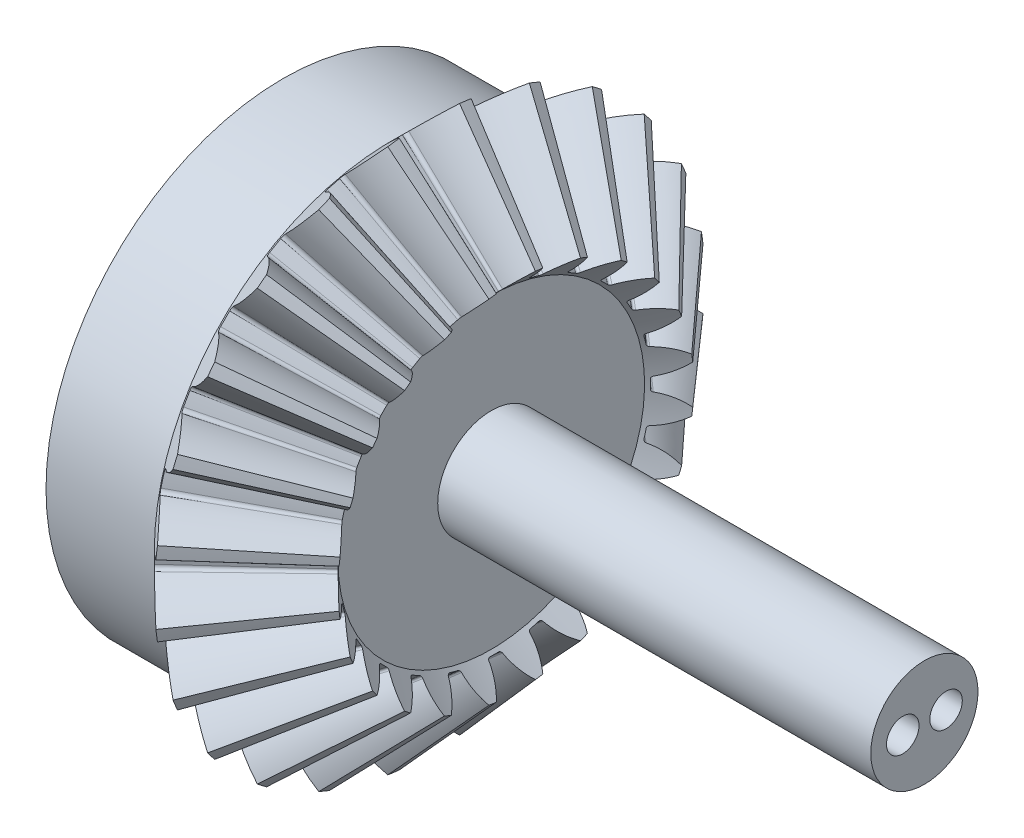
from build123d import *

# Parameters (mm, degrees)
TEETHCUTS_COUNT     = 24
TEETHCUTS_ANGLE     = 345
HUBSKE_R            = 21.899008976
HUB_DEPTH           = 0.0001016
BORSKE_R            = 8
BORE_DEPTH          = 26.101041824
SKETCH1_R           = 21.899008976
SKETCH1_R_2         = 8
BOSS_EXTRUDE1_DEPTH = 10
BOSS_EXTRUDE2_START = -19.228195468
SKETCH2_R           = 8
BOSS_EXTRUDE2_DEPTH = 19.228195468
SKETCH3_R           = 4.95
SKETCH3_R_2         = 1.5
BOSS_EXTRUDE3_DEPTH = 40
CUT_EXTRUDE1_START  = -20
SKETCH5_R           = 1.5
CUT_EXTRUDE1_DEPTH  = 20


with BuildPart() as part:
    # BasProSke → Base-Revolve (revolve)
    with BuildSketch(Plane(origin=(0, 0, 0), x_dir=(1, 0, 0), z_dir=(0, 1, 0)), mode=Mode.PRIVATE) as base_revolve_sk:
        Polygon((0, 0), (0, 21.899008978), (3.515204589, 25.414213561), (11.500485955, 16.428932179), (9.228093868, 14.156540096), (9.228093868, 0), align=None)
    revolve(base_revolve_sk.sketch.rotate(Axis((-10, 0, 0), (1, 0, 0)), 180), axis=Axis((-10, 0, 0), (1, 0, 0)))

    # ToothCut: read off the stored shape, not the designer's step
    # ToothCut: loft between two sections, ruled curve by curve
    toothcut_from = [
        Edge.make_bspline([(26.10720239, 0.006211364, -0.009172097), (26.102912454, 0.001921428, -0.014982426), (26.097002164, -0.003988861, -0.014143385), (26.093614444, -0.007376582, -0.007243115)], [0, 0, 0, 0, 1, 1, 1, 1], 3, [1, 0.76634411, 0.76634411, 1]),
        Edge.make_bspline([(26.093614444, -0.007376582, 0.007243115), (26.097002164, -0.003988861, 0.014143385), (26.102912454, 0.001921428, 0.014982426), (26.10720239, 0.006211364, 0.009172097)], [0, 0, 0, 0, 1, 1, 1, 1], 3, [1, 0.76634411, 0.76634411, 1]),
        Edge.make_bspline([(26.093614444, -0.007376582, -0.007243115), (26.093148172, -0.007842854, -0.006293391), (26.092777356, -0.00821367, -0.005262961), (26.092508857, -0.008482169, -0.004170894)], [0, 0, 0, 0, 1, 1, 1, 1], 3, [1, 0.993831806, 0.993831806, 1]),
        Edge.make_bspline([(26.092508857, -0.008482169, 0.004170894), (26.092777356, -0.00821367, 0.005262961), (26.093148172, -0.007842854, 0.006293391), (26.093614444, -0.007376582, 0.007243115)], [0, 0, 0, 0, 1, 1, 1, 1], 3, [1, 0.993831806, 0.993831806, 1]),
        Edge.make_bspline([(26.092508857, -0.008482169, -0.004170894), (26.091838336, -0.009152689, -0.001443682), (26.091838336, -0.009152689, 0.001443682), (26.092508857, -0.008482169, 0.004170894)], [0, 0, 0, 0, 1, 1, 1, 1], 3, [1, 0.963021929, 0.963021929, 1]),
        Edge.make_line((26.10720239, 0.006211364, 0.009172097), (26.10720239, 0.006211364, -0.009172097)),
    ]
    toothcut_to = [
        Edge.make_bspline([(3.750237088, 25.64924606, -3.148942644), (2.856031609, 24.755040582, -2.045484157), (1.79166118, 23.690670155, -1.303150883), (0.628286037, 22.527295014, -0.971572738)], [0, 0, 0, 0, 1, 1, 1, 1], 3, [1, 0.977714451, 0.977714451, 1]),
        Edge.make_bspline([(0.628286037, 22.527295014, 0.971572738), (1.79166118, 23.690670155, 1.303150883), (2.856031609, 24.755040582, 2.045484157), (3.750237088, 25.64924606, 3.148942644)], [0, 0, 0, 0, 1, 1, 1, 1], 3, [1, 0.977714451, 0.977714451, 1]),
        Edge.make_bspline([(0.628286037, 22.527295014, -0.971572738), (0.495266175, 22.394275152, -0.933660221), (0.410759708, 22.309768685, -0.783516157), (0.41447282, 22.313481797, -0.591687192)], [0, 0, 0, 0, 1, 1, 1, 1], 3, [1, 0.843380094, 0.843380094, 1]),
        Edge.make_bspline([(0.41447282, 22.313481797, 0.591687192), (0.410759708, 22.309768685, 0.783516157), (0.495266175, 22.394275152, 0.933660221), (0.628286037, 22.527295014, 0.971572738)], [0, 0, 0, 0, 1, 1, 1, 1], 3, [1, 0.843380094, 0.843380094, 1]),
        Edge.make_bspline([(0.41447282, 22.313481797, -0.591687192), (0.422107143, 22.321116121, -0.197278313), (0.422107143, 22.321116121, 0.197278313), (0.41447282, 22.313481797, 0.591687192)], [0, 0, 0, 0, 1, 1, 1, 1], 3, [1, 0.999750361, 0.999750361, 1]),
        Edge.make_line((3.750237088, 25.64924606, 3.148942644), (3.750237088, 25.64924606, -3.148942644)),
    ]
    toothcut = Solid(Shell([*[Face.make_surface_from_curves(toothcut_from[k], toothcut_to[k]) for k in range(6)], Face(Wire(toothcut_from)), Face(Wire(toothcut_to))]))
    add(toothcut, mode=Mode.SUBTRACT)

    # TeethCuts: ToothCut ×24 about axis
    teethcuts_axis = Axis((-10, 0, 0), (1, 0, 0))
    for i in range(1, TEETHCUTS_COUNT):
        add(toothcut.rotate(teethcuts_axis, i * TEETHCUTS_ANGLE / (TEETHCUTS_COUNT - 1)), mode=Mode.SUBTRACT)

    # HubSke → Hub (add)
    with BuildSketch(Plane.ZY):
        Circle(HUBSKE_R)
    extrude(amount=HUB_DEPTH)

    # BorSke → Bore (cut, symmetric)
    with BuildSketch(Plane(origin=(0, 0, 0), x_dir=(0, 0, -1), z_dir=(1, 0, 0))):
        with Locations(Location((0, 0, 0), (0, 0, 180))):
            Circle(BORSKE_R)
    extrude(amount=BORE_DEPTH, both=True, mode=Mode.SUBTRACT)

    # Sketch1 → Boss-Extrude1 (add)
    with BuildSketch(Plane.ZY.offset(0.0001016)):
        Circle(SKETCH1_R)
        Circle(SKETCH1_R_2, mode=Mode.SUBTRACT)
    extrude(amount=BOSS_EXTRUDE1_DEPTH)

    # Sketch2 → Boss-Extrude2 (add)
    with BuildSketch(Plane.ZY.offset(10.0001016).offset(BOSS_EXTRUDE2_START)):
        Circle(SKETCH2_R)
    extrude(amount=BOSS_EXTRUDE2_DEPTH)

    # Sketch3 → Boss-Extrude3 (add)
    with BuildSketch(Plane(origin=(9.228093868, 0, 0), x_dir=(0, 0, -1), z_dir=(1, 0, 0))):
        with Locations(Location((0, 0, 0), (0, 0, 180))):
            Circle(SKETCH3_R)
        with Locations((2, 0)):
            Circle(SKETCH3_R_2, mode=Mode.SUBTRACT)
        with Locations((-2, 0)):
            Circle(SKETCH3_R_2, mode=Mode.SUBTRACT)
    extrude(amount=BOSS_EXTRUDE3_DEPTH)

    # Sketch5 → Cut-Extrude1 (cut)
    with BuildSketch(Plane(origin=(9.228093868, 0, 0), x_dir=(0, 0, -1), z_dir=(1, 0, 0)).offset(CUT_EXTRUDE1_START)):
        with Locations(Location((-2, 0, 0), (0, 0, 180))):
            Circle(SKETCH5_R)
        with Locations(Location((2, 0, 0), (0, 0, 180))):
            Circle(SKETCH5_R)
    extrude(amount=CUT_EXTRUDE1_DEPTH, mode=Mode.SUBTRACT)


solid = part.part
